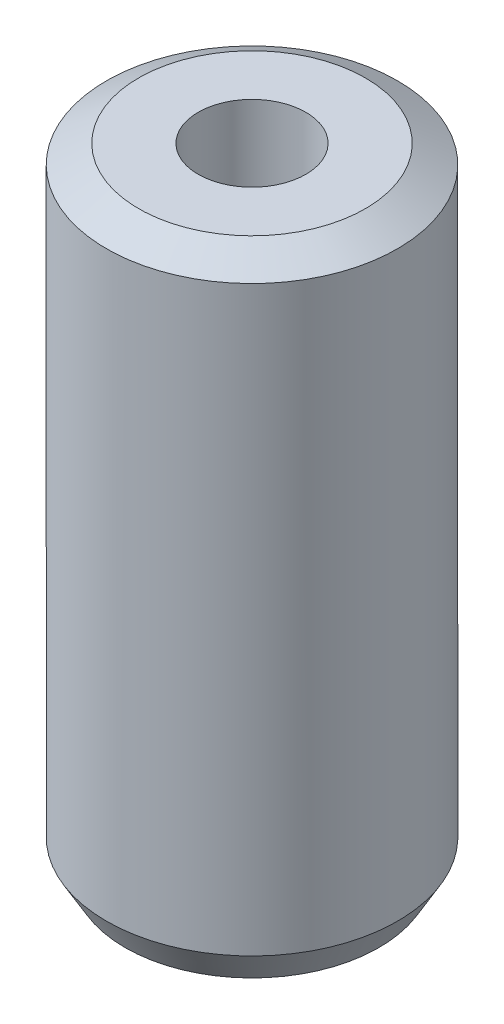
from build123d import *
from OCP.BRepFilletAPI import BRepFilletAPI_MakeChamfer

# Parameters (mm, degrees)
SKETCH1_R           = 15
BOSS_EXTRUDE1_DEPTH = 65.259185296
SKETCH2_R           = 5.547283787
CUT_EXTRUDE1_DEPTH  = 69.620414349
CHAMFER1_SIZE       = 1.915754086
CHAMFER1_SIZE2      = 3.318183411


with BuildPart() as part:
    # Sketch1 → Boss-Extrude1 (new body)
    with BuildSketch(Plane(origin=(0, 0, 0), x_dir=(1, 0, 0), z_dir=(0, 1, 0))):
        Circle(SKETCH1_R)
    extrude(amount=BOSS_EXTRUDE1_DEPTH)

    # Sketch2 → Cut-Extrude1 (cut, through all)
    with BuildSketch(Plane(origin=(0, 0, 0), x_dir=(1, 0, 0), z_dir=(0, 1, 0))):
        Circle(SKETCH2_R)
    extrude(amount=CUT_EXTRUDE1_DEPTH, mode=Mode.SUBTRACT)

    # Chamfer1: one chamfer whose edges measure the first distance from different faces: ONE call of the kernel's chamfer builder (chamfer() names one face for all edges)
    chamfer1_edges_1 = [part.edges().sort_by_distance(p)[0] for p in [
        (-15, 65.259185296, 0),
    ]]
    chamfer1_side_1 = [part.faces().sort_by_distance(p)[0] for p in [
        (-15, 32.629592648, 0),
    ]]
    chamfer1_edges_2 = [part.edges().sort_by_distance(p)[0] for p in [
        (-15, 0, 0),
    ]]
    chamfer1_side_2 = [part.faces().sort_by_distance(p)[0] for p in [
        (-14.575735931, 0, 0),
    ]]
    chamfer1 = BRepFilletAPI_MakeChamfer(part.part.solid().wrapped)
    for e in chamfer1_edges_1:
        chamfer1.Add(CHAMFER1_SIZE, CHAMFER1_SIZE2, e.wrapped, chamfer1_side_1[0].wrapped)  # the first distance lies on this face
    for e in chamfer1_edges_2:
        chamfer1.Add(CHAMFER1_SIZE, CHAMFER1_SIZE2, e.wrapped, chamfer1_side_2[0].wrapped)  # the first distance lies on this face
    add(Compound.cast(chamfer1.Shape()), mode=Mode.REPLACE)


solid = part.part
